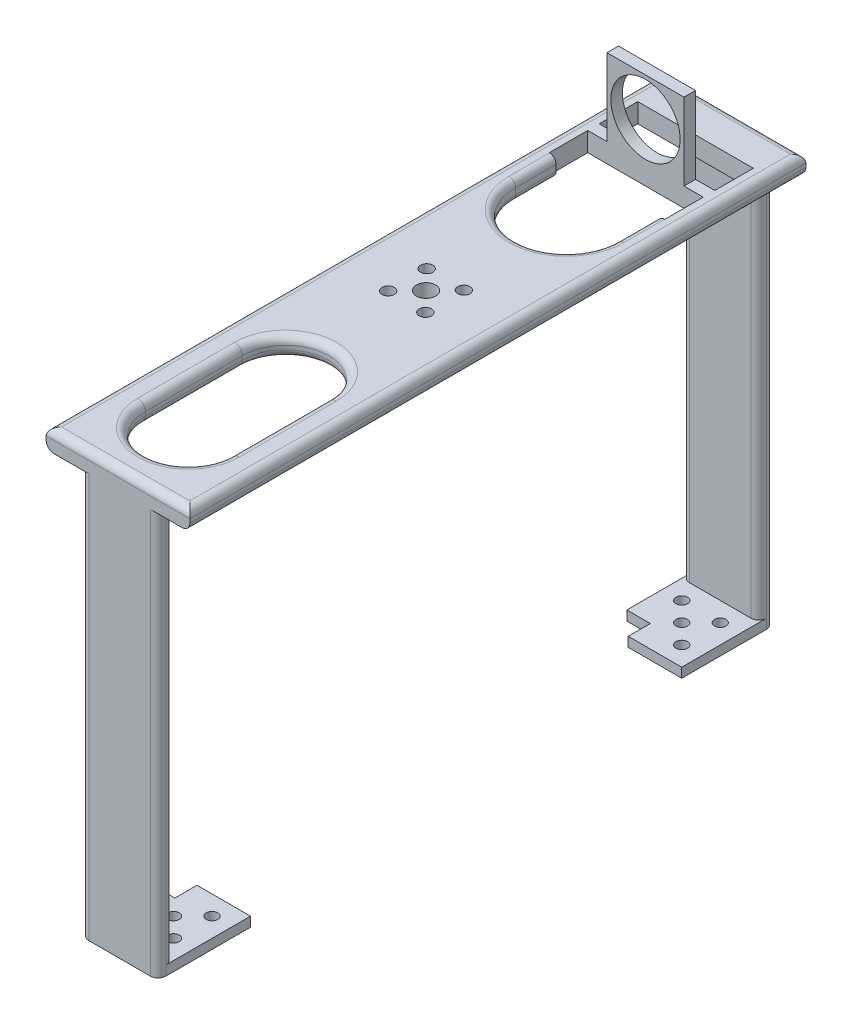
from build123d import *

# Parameters (mm, degrees)
EXTRUDE_2_DEPTH      = 160
SKETCH_20_W          = 20
SKETCH_20_H          = 4
EXTRUDE_5_DEPTH      = 105
SKETCH_24_R          = 1.5
EXTRUDE_7_DEPTH      = 2.5
SKETCH_25_W          = 203
SKETCH_25_H          = 2.5
CUT_EXTRUDE_16_DEPTH = 280.937939551
SKETCH_27_W          = 37.304830233
SKETCH_27_H          = 160
EXTRUDE_8_DEPTH      = 5
CUT_EXTRUDE_17_REACH = 214.095
SKETCH_28_R          = 1.6
SKETCH_28_R_2        = 2.5
SKETCH_29_W          = 20
SKETCH_29_H          = 3
EXTRUDE_9_DEPTH      = 20
SKETCH_30_R          = 9
CUT_EXTRUDE_18_DEPTH = 3
SKETCH_31_W          = 30
SKETCH_31_H          = 10
CUT_EXTRUDE_19_DEPTH = 5.6
FILLET_1_R           = 2
FILLET_2_R           = 2
FILLET_3_R           = 2
CUT_EXTRUDE_20_DEPTH = 10
FILLET_4_R           = 1.7


with BuildPart() as part:
    # 草图1 → 凸台-拉伸2 (new body)
    with BuildSketch(Plane.XY):
        Polygon((0, 0), (203, 0), (203, 2.5), (126.5, 2.5), (124, 2.5), (81.5, 2.5), (79, 2.5), (0, 2.5), align=None)
    extrude(amount=EXTRUDE_2_DEPTH)

    # 草图20 → 凸台-拉伸5 (add)
    with BuildSketch(Plane(origin=(0, 2.5, 0), x_dir=(1, 0, 0), z_dir=(0, 1, 0))):
        with Locations((67.115040288, -158)):
            Rectangle(SKETCH_20_W, SKETCH_20_H)
        with Locations((67.115040288, -2)):
            Rectangle(SKETCH_20_W, SKETCH_20_H)
    extrude(amount=EXTRUDE_5_DEPTH)

    # 草图24 → 凸台-拉伸7 (add)
    # profile 1 of 2: a face of its own
    with BuildSketch(Plane(origin=(0, 2.5, 0), x_dir=(1, 0, 0), z_dir=(0, 1, 0))):
        Polygon((57.115040288, -4), (77.115040288, -4), (77.115040288, -24), (63.211726749, -24), (63.211726749, -18.265887292), (57.115040288, -18.265887292), align=None)
        with Locations(Location((72.115040288, -9, 0), (0, 0, 270))):
            Circle(SKETCH_24_R, mode=Mode.SUBTRACT)
        with Locations(Location((67.115040288, -14, 0), (0, 0, 270))):
            Circle(SKETCH_24_R, mode=Mode.SUBTRACT)
        with Locations(Location((62.115040288, -9, 0), (0, 0, 90))):
            Circle(SKETCH_24_R, mode=Mode.SUBTRACT)
        with Locations(Location((72.115040288, -19, 0), (0, 0, 90))):
            Circle(SKETCH_24_R, mode=Mode.SUBTRACT)
    # profile 2 of 2: a face of its own
    with BuildSketch(Plane(origin=(0, 2.5, 0), x_dir=(1, 0, 0), z_dir=(0, 1, 0))):
        Polygon((63.211726749, -136), (77.115040288, -136), (77.115040288, -156), (57.115040288, -156), (57.115040288, -141.734112708), (63.211726749, -141.734112708), align=None)
        with Locations(Location((67.115040288, -146, 0), (0, 0, 90))):
            Circle(SKETCH_24_R, mode=Mode.SUBTRACT)
        with Locations(Location((72.115040288, -141, 0), (0, 0, 270))):
            Circle(SKETCH_24_R, mode=Mode.SUBTRACT)
        with Locations(Location((72.115040288, -151, 0), (0, 0, 90))):
            Circle(SKETCH_24_R, mode=Mode.SUBTRACT)
        with Locations(Location((62.115040288, -151, 0), (0, 0, 270))):
            Circle(SKETCH_24_R, mode=Mode.SUBTRACT)
    extrude(amount=EXTRUDE_7_DEPTH)

    # 草图25 → 切除-拉伸16 (cut, through all)
    with BuildSketch(Plane.XY.offset(160)):
        with Locations((101.5, 1.25)):
            Rectangle(SKETCH_25_W, SKETCH_25_H)
    extrude(amount=-CUT_EXTRUDE_16_DEPTH, mode=Mode.SUBTRACT)


with BuildPart() as cut_extrude_16_piece_1:
    # of the separate pieces the step leaves, piece 1, a body of its own (cut_extrude_16_pieces)
    add(part.part.solids().sort_by_distance((57.115040288, 2.5, 0))[0])



with BuildPart() as cut_extrude_16_piece_2:
    # of the separate pieces the step leaves, piece 2, a body of its own (cut_extrude_16_pieces)
    add(part.part.solids().sort_by_distance((57.115040288, 2.5, 160))[0])


with BuildPart() as cut_extrude_16_piece_1_1:
    add(cut_extrude_16_piece_1.part)

    add(cut_extrude_16_piece_2.part)  # 凸台-拉伸8 merges 切除-拉伸16 piece 2
    # 草图27 → 凸台-拉伸8 (add)
    with BuildSketch(Plane(origin=(0, 107.5, 0), x_dir=(1, 0, 0), z_dir=(0, 1, 0))):
        with Locations((66.694824847, -80)):
            Rectangle(SKETCH_27_W, SKETCH_27_H)
    extrude(amount=EXTRUDE_8_DEPTH)

    # 草图28 → 切除-拉伸17 (cut, up to next)
    with BuildSketch(Plane(origin=(0, 112.5, 0), x_dir=(1, 0, 0), z_dir=(0, 1, 0)), mode=Mode.PRIVATE) as cut_extrude_17_sk1:
        with Locations(Location((61.867974578, -75, 0), (0, 0, 270))):
            Circle(SKETCH_28_R)
    cut_extrude_17_tool1 = extrude(cut_extrude_17_sk1.sketch, amount=-CUT_EXTRUDE_17_REACH, mode=Mode.PRIVATE) & cut_extrude_16_piece_1_1.part
    # 草图28 → 切除-拉伸17 (cut, up to next)
    with BuildSketch(Plane(origin=(0, 112.5, 0), x_dir=(1, 0, 0), z_dir=(0, 1, 0)), mode=Mode.PRIVATE) as cut_extrude_17_sk2:
        with Locations(Location((61.867974578, -85, 0), (0, 0, 270))):
            Circle(SKETCH_28_R)
    cut_extrude_17_tool2 = extrude(cut_extrude_17_sk2.sketch, amount=-CUT_EXTRUDE_17_REACH, mode=Mode.PRIVATE) & cut_extrude_16_piece_1_1.part
    # 草图28 → 切除-拉伸17 (cut, up to next)
    with BuildSketch(Plane(origin=(0, 112.5, 0), x_dir=(1, 0, 0), z_dir=(0, 1, 0)), mode=Mode.PRIVATE) as cut_extrude_17_sk3:
        with Locations(Location((66.694824846, -80, 0), (0, 0, 270))):
            Circle(SKETCH_28_R_2)
    cut_extrude_17_tool3 = extrude(cut_extrude_17_sk3.sketch, amount=-CUT_EXTRUDE_17_REACH, mode=Mode.PRIVATE) & cut_extrude_16_piece_1_1.part
    # 草图28 → 切除-拉伸17 (cut, up to next)
    with BuildSketch(Plane(origin=(0, 112.5, 0), x_dir=(1, 0, 0), z_dir=(0, 1, 0)), mode=Mode.PRIVATE) as cut_extrude_17_sk4:
        with Locations(Location((71.521675114, -75, 0), (0, 0, 270))):
            Circle(SKETCH_28_R)
    cut_extrude_17_tool4 = extrude(cut_extrude_17_sk4.sketch, amount=-CUT_EXTRUDE_17_REACH, mode=Mode.PRIVATE) & cut_extrude_16_piece_1_1.part
    # 草图28 → 切除-拉伸17 (cut, up to next)
    with BuildSketch(Plane(origin=(0, 112.5, 0), x_dir=(1, 0, 0), z_dir=(0, 1, 0)), mode=Mode.PRIVATE) as cut_extrude_17_sk5:
        with Locations(Location((71.521675114, -85, 0), (0, 0, 270))):
            Circle(SKETCH_28_R)
    cut_extrude_17_tool5 = extrude(cut_extrude_17_sk5.sketch, amount=-CUT_EXTRUDE_17_REACH, mode=Mode.PRIVATE) & cut_extrude_16_piece_1_1.part
    # 草图28 → 切除-拉伸17 (cut, up to next)
    with BuildSketch(Plane(origin=(0, 112.5, 0), x_dir=(1, 0, 0), z_dir=(0, 1, 0)), mode=Mode.PRIVATE) as cut_extrude_17_sk6:
        with BuildLine():
            Line((77.92150076, -141.671137219), (77.92150076, -116.497525995))
            ThreePointArc((77.92150076, -116.497525995), (66.694824846, -105.270850081), (55.468148932, -116.497525995))
            Line((55.468148932, -116.497525995), (55.468148932, -141.671137219))
            ThreePointArc((55.468148932, -141.671137219), (66.694824846, -152.897813133), (77.92150076, -141.671137219))
        make_face()
    cut_extrude_17_tool6 = extrude(cut_extrude_17_sk6.sketch, amount=-CUT_EXTRUDE_17_REACH, mode=Mode.PRIVATE) & cut_extrude_16_piece_1_1.part
    add(cut_extrude_17_tool1.solids().sort_by_distance((61.867975, 112.5, 75))[0], mode=Mode.SUBTRACT)
    add(cut_extrude_17_tool2.solids().sort_by_distance((61.867975, 112.5, 85))[0], mode=Mode.SUBTRACT)
    add(cut_extrude_17_tool3.solids().sort_by_distance((66.694825, 112.5, 80))[0], mode=Mode.SUBTRACT)
    add(cut_extrude_17_tool4.solids().sort_by_distance((71.521675, 112.5, 75))[0], mode=Mode.SUBTRACT)
    add(cut_extrude_17_tool5.solids().sort_by_distance((71.521675, 112.5, 85))[0], mode=Mode.SUBTRACT)
    add(cut_extrude_17_tool6.solids().sort_by_distance((66.694825, 112.5, 129.084332))[0], mode=Mode.SUBTRACT)

    # 草图29 → 凸台-拉伸9 (add)
    with BuildSketch(Plane(origin=(0, 112.5, 0), x_dir=(1, 0, 0), z_dir=(0, 1, 0))):
        with Locations((66.694824846, -21.5)):
            Rectangle(SKETCH_29_W, SKETCH_29_H)
    extrude(amount=EXTRUDE_9_DEPTH)

    # 草图30 → 切除-拉伸18 (cut)
    with BuildSketch(Plane(origin=(0, 0, 20), x_dir=(-1, 0, 0), z_dir=(0, 0, -1))):
        with Locations((-66.694824846, 122.5)):
            Circle(SKETCH_30_R)
    extrude(amount=-CUT_EXTRUDE_18_DEPTH, mode=Mode.SUBTRACT)

    # 草图31 → 切除-拉伸19 (cut)
    with BuildSketch(Plane(origin=(0, 112.5, 0), x_dir=(1, 0, 0), z_dir=(0, 1, 0))):
        with Locations((66.694824846, -15)):
            Rectangle(SKETCH_31_W, SKETCH_31_H)
        with Locations((66.694824846, -28)):
            Rectangle(SKETCH_31_W, SKETCH_31_H)
    extrude(amount=-CUT_EXTRUDE_19_DEPTH, mode=Mode.SUBTRACT)

    # 圆角1
    fillet_1_edges = [cut_extrude_16_piece_1_1.edges().sort_by_distance(p)[0] for p in [
        (85.347239963, 107.5, 80),
        (48.04240973, 107.5, 80),
        (85.347239963, 112.5, 80),
        (66.694824846, 112.5, 0),
        (48.04240973, 112.5, 80),
        (66.694824846, 112.5, 160),
    ]]
    fillet(fillet_1_edges, radius=FILLET_1_R)

    # 圆角2
    fillet_2_edges = [cut_extrude_16_piece_1_1.edges().sort_by_distance(p)[0] for p in [
        (57.115040288, 55, 160),
        (57.115040288, 56.25, 156),
        (77.115040288, 56.25, 156),
        (77.115040288, 55, 160),
        (77.115040288, 56.25, 4),
        (77.115040288, 55, 0),
        (57.115040288, 56.25, 4),
        (57.115040288, 55, 0),
    ]]
    fillet(fillet_2_edges, radius=FILLET_2_R - 0.0001)  # a hair under: the kernel refuses the full size

    # 圆角3
    fillet_3_edges = [cut_extrude_16_piece_1_1.edges().sort_by_distance(p)[0] for p in [
        (66.694824846, 112.5, 152.897813133),
        (77.92150076, 112.5, 129.084331607),
        (66.694824846, 112.5, 105.270850081),
        (55.468148932, 112.5, 129.084331607),
        (77.92150076, 107.5, 129.084331607),
        (66.694824846, 107.5, 152.897813133),
        (55.468148932, 107.5, 129.084331607),
        (66.694824846, 107.5, 105.270850081),
    ]]
    fillet(fillet_3_edges, radius=FILLET_3_R)

    # 草图33 → 切除-拉伸20 (cut)
    with BuildSketch(Plane(origin=(0, 112.5, 0), x_dir=(1, 0, 0), z_dir=(0, 1, 0))):
        with BuildLine():
            Line((53.468148932, -43.502474005), (53.468148932, -33))
            Line((53.468148932, -33), (79.92150076, -33))
            Line((79.92150076, -33), (79.92150076, -43.502474005))
            ThreePointArc((79.92150076, -43.502474005), (66.694824846, -56.729149919), (53.468148932, -43.502474005))
        make_face()
    extrude(amount=-CUT_EXTRUDE_20_DEPTH, mode=Mode.SUBTRACT)

    # 圆角4
    fillet_4_edges = [cut_extrude_16_piece_1_1.edges().sort_by_distance(p)[0] for p in [
        (66.694824846, 107.5, 56.729149919),
        (79.92150076, 107.5, 38.251237003),
        (53.468148932, 107.5, 38.251237003),
        (53.468148932, 112.5, 38.251237003),
        (66.694824846, 112.5, 56.729149919),
        (79.92150076, 112.5, 38.251237003),
    ]]
    fillet(fillet_4_edges, radius=FILLET_4_R)


solid = cut_extrude_16_piece_1_1.part
